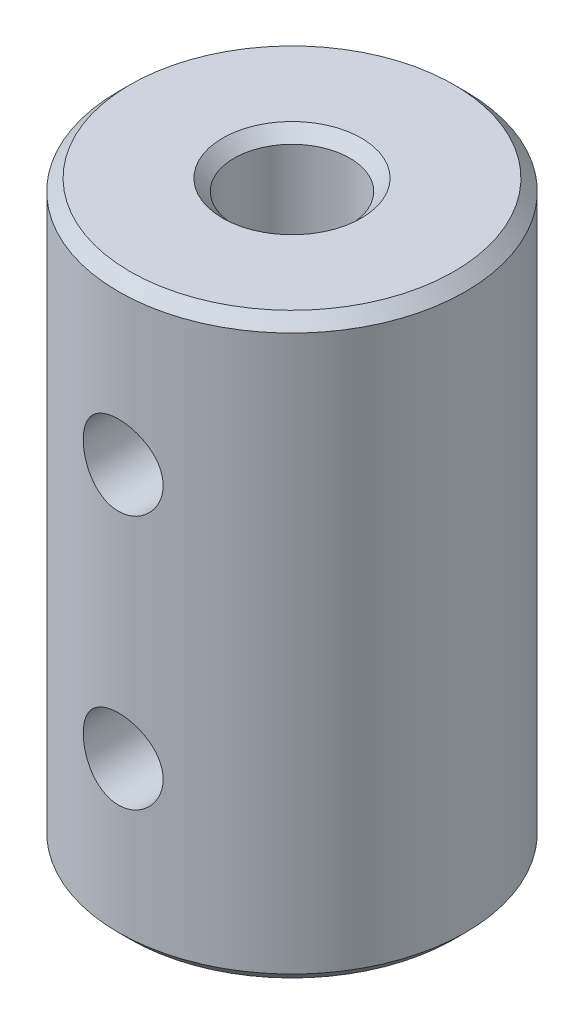
from build123d import *

# Parameters (mm, degrees)
SKETCH1_R                 = 7.5
SKETCH1_R_2               = 2.5
BOSS_EXTRUDE1_DEPTH       = 25
CHAMFER1_SIZE             = 0.5
F_8_32_TAPPED_HOLE1_D     = 3.4544
F_8_32_TAPPED_HOLE1_DEPTH = 18
F_8_32_TAPPED_HOLE1_TIP   = 1.037806461


with BuildPart() as part:
    # Sketch1 → Boss-Extrude1 (new body)
    with BuildSketch(Plane(origin=(0, 0, 0), x_dir=(1, 0, 0), z_dir=(0, 1, 0))):
        Circle(SKETCH1_R)
        Circle(SKETCH1_R_2, mode=Mode.SUBTRACT)
    extrude(amount=BOSS_EXTRUDE1_DEPTH)

    # Chamfer1
    chamfer1_edges = [part.edges().sort_by_distance(p)[0] for p in [
        (-2.5, 0, 0),
        (-7.5, 0, 0),
        (-2.5, 25, 0),
        (-7.5, 25, 0),
    ]]
    chamfer(chamfer1_edges, length=CHAMFER1_SIZE)

    # #8-32 Tapped Hole1
    with Locations(Plane.XY.offset(19.05)):
        with Locations((0, 18), (0, 7)):
            Hole(F_8_32_TAPPED_HOLE1_D / 2, depth=F_8_32_TAPPED_HOLE1_DEPTH)
            with Locations((0, 0, -(F_8_32_TAPPED_HOLE1_DEPTH + F_8_32_TAPPED_HOLE1_TIP / 2))):  # 118° drill point
                Cone(0, F_8_32_TAPPED_HOLE1_D / 2, F_8_32_TAPPED_HOLE1_TIP, mode=Mode.SUBTRACT)


solid = part.part
